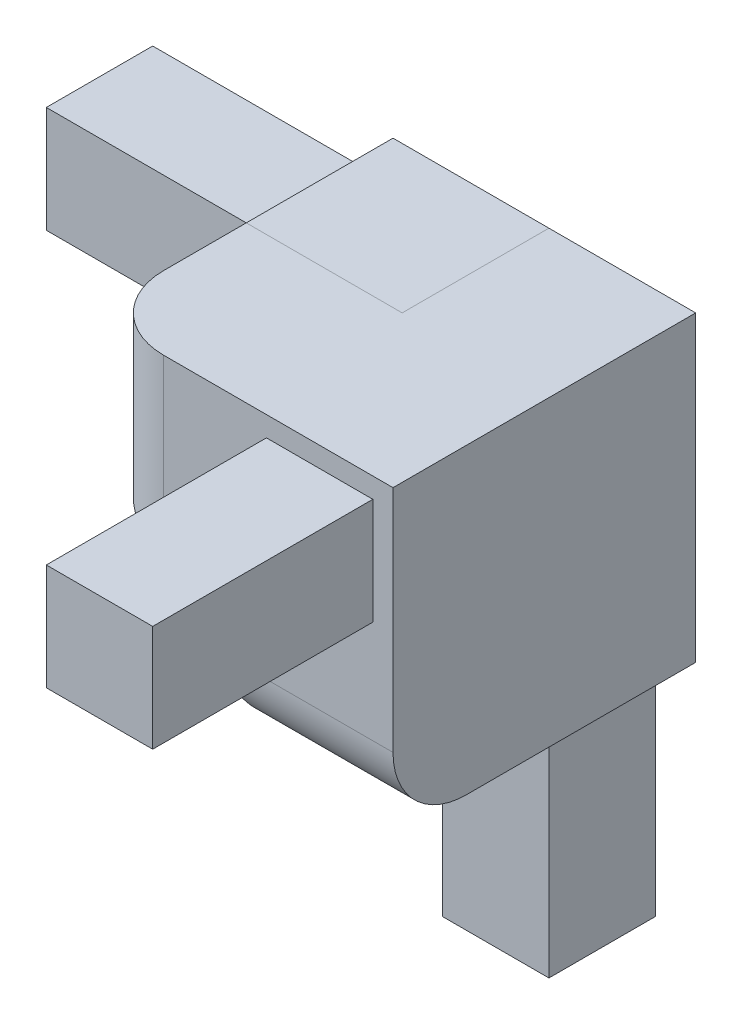
from build123d import *

# Parameters (mm, degrees)
BOSS_EXTRUDE1_DEPTH     = 12
BOSS_EXTRUDE2_DEPTH     = 12
BOSS_EXTRUDE3_DEPTH     = 12
SKETCH4_W               = 8
SKETCH4_H               = 8
BOSS_EXTRUDE4_DEPTH     = 16.5
SKETCH5_W               = 7.999993884
SKETCH5_H               = 7.999993884
BOSS_EXTRUDE5_DEPTH     = 16.5
SKETCH6_W               = 8
SKETCH6_H               = 8
BOSS_EXTRUDE6_DEPTH     = 16.5
SKETCH8_W               = 16.5
SKETCH8_H               = 16.5
BOSS_EXTRUDE7_DEPTH     = 16.5
CUT_EXTRUDE1_DEPTH      = 46.53156728
CUT_EXTRUDE1_DEPTH_BACK = 10
SKETCH7_R               = 3.375
FILLET2_R               = 4
THREAD1_PITCH           = 1.25
CUT_EXTRUDE4_REACH      = 46.455
SKETCH13_R              = 7.5


with BuildPart() as part:
    # Sketch1 → Boss-Extrude1 (new body)
    with BuildSketch(Plane(origin=(0, 35.05419916, 0), x_dir=(0.9999999620637957, 0, 0.0002754494639987689), z_dir=(0, 1, 0))):
        Polygon((19.155740079, 21.200002591), (24.955739859, 21.201600197), (24.954142252, 27.001599977), (19.154142472, 27.00000237), align=None)
    extrude(amount=-BOSS_EXTRUDE1_DEPTH)



with BuildPart() as body_2:
    # Sketch2 → Boss-Extrude2 (new body)
    with BuildSketch(Plane(origin=(9.561578882, 0, 0), x_dir=(0, 7.645378823372435e-07, -0.9999999999997079), z_dir=(1, 0, 0))):
        Polygon((26.994759488, 44.654178522), (26.994763922, 50.454178522), (21.194763922, 50.454182956), (21.194759488, 44.654182956), align=None)
    extrude(amount=-BOSS_EXTRUDE2_DEPTH)



with BuildPart() as body_3:
    # Sketch3 → Boss-Extrude3 (new body)
    with BuildSketch(Plane(origin=(0, 0, -11.594725348), x_dir=(-0.9999999616408898, -0.00027698053959765754, 0), z_dir=(0, 0, -1))):
        Polygon((-24.975552756, 50.447283353), (-24.973946268, 44.647283576), (-19.173946491, 44.648890063), (-19.175552978, 50.448889841), align=None)
    extrude(amount=-BOSS_EXTRUDE3_DEPTH)

    # Sketch4 → Boss-Extrude4 (add)
    with BuildSketch(Plane(origin=(0, 0, -11.594725348), x_dir=(-1, 0, 0), z_dir=(0, 0, -1))):
        with Locations((-22.061578882, 47.55419916)):
            Rectangle(SKETCH4_W, SKETCH4_H)
    extrude(amount=BOSS_EXTRUDE4_DEPTH)


with BuildPart() as body_2_1:
    add(body_2.part)

    add(body_3.part)  # Boss-Extrude5 merges body 3
    # Sketch5 → Boss-Extrude5 (add)
    with BuildSketch(Plane(origin=(9.561578882, 0, 0), x_dir=(0, 7.645378823474896e-07, -0.9999999999997079), z_dir=(1, 0, 0))):
        with Locations((24.094767821, 47.554180739)):
            Rectangle(SKETCH5_W, SKETCH5_H)
    extrude(amount=BOSS_EXTRUDE5_DEPTH)


with BuildPart() as part_1:
    add(part.part)

    add(body_2_1.part)  # Boss-Extrude6 merges body 2
    # Sketch6 → Boss-Extrude6 (add)
    with BuildSketch(Plane(origin=(0, 35.05419916, 0), x_dir=(1, 0, 0), z_dir=(0, 1, 0))):
        with Locations((22.061578882, 24.094737957)):
            Rectangle(SKETCH6_W, SKETCH6_H)
    extrude(amount=BOSS_EXTRUDE6_DEPTH)

    # Sketch8 → Boss-Extrude7 (add)
    with BuildSketch(Plane.XY.offset(-11.594725348)):
        with Locations((17.811578882, 43.30419916)):
            Rectangle(SKETCH8_W, SKETCH8_H)
    extrude(amount=-BOSS_EXTRUDE7_DEPTH)

    # Sketch7 → Cut-Extrude1 (cut, two sides: drawn at the far end of the back side and taken through both)
    with BuildSketch(Plane(origin=(24.403518903, 24.403519985, -24.403483784), x_dir=(-0.8164963911191215, 0.4082487828215975, -0.40824817772298094), z_dir=(-0.577350537619435, -0.5773505632103234, 0.5773497067387079)).offset(-CUT_EXTRUDE1_DEPTH_BACK)):
        with Locations((11.237364984, -16.588328554)):
            Circle(SKETCH7_R)
    extrude(amount=CUT_EXTRUDE1_DEPTH + CUT_EXTRUDE1_DEPTH_BACK, mode=Mode.SUBTRACT)

    # Fillet2
    fillet2_edges = [part_1.edges().sort_by_distance(p)[0] for p in [
        (19.878336333, 35.05419916, -11.594725348),
        (9.561578882, 45.370956657, -11.594725348),
        (9.561578882, 35.05419916, -21.911481312),
    ]]
    fillet(fillet2_edges, radius=FILLET2_R)

    # Thread1: the profile of Thread Profile1 profile screwed along a right-hand helix of 16 turns, 8 arcs to a turn; built about Z, then put on its axis
    thread1_z = Axis((0, 0, 0), (0, 0, 1))
    thread1_corners = [(3.3747, 1e-09, -0.000173204), (4.051582343, 1e-09, 0.390624999), (4.051582343, 1e-09, 0.546874999), (3.374699999, 1e-09, 0.937673202)]
    with BuildLine(mode=Mode.PRIVATE) as thread1_profile:
        Line(thread1_corners[0], thread1_corners[1])
        Line(thread1_corners[1], thread1_corners[2])
        Line(thread1_corners[2], thread1_corners[3])
        Line(thread1_corners[3], thread1_corners[0])
    thread1_cap = Face(thread1_profile.wire())
    thread1_turn_angles = [0, 22.5, 45, 67.5, 90, 112.5, 135, 157.5, 180, 202.5, 225, 247.5, 270, 292.5, 315, 337.5, 360]
    thread1_turn_weights = [1, 0.9238795325112867, 1, 0.9238795325112867, 1, 0.9238795325112867, 1, 0.9238795325112867, 1, 0.9238795325112867, 1, 0.9238795325112867, 1, 0.9238795325112867, 1, 0.9238795325112867, 1]
    thread1_turn_rails = [Edge.make_bspline([Vector(p[0], p[1], 0).rotate(thread1_z, thread1_turn_angles[k]) / thread1_turn_weights[k] + Vector(0, 0, p[2] + THREAD1_PITCH * thread1_turn_angles[k] / 360) for k in range(17)], [0, 0, 0, 1, 1, 2, 2, 3, 3, 4, 4, 5, 5, 6, 6, 7, 7, 8, 8, 8], 2, thread1_turn_weights) for p in thread1_corners]
    thread1_turn_sides = [Face.make_surface_from_curves(thread1_turn_rails[p[0]], thread1_turn_rails[p[1]]) for p in [(0, 1), (1, 2), (2, 3), (3, 0)]]
    thread1 = Plane(origin=(21.001756319, 46.494377105, -23.034886322), x_dir=(-0.816496391, 0.408248783, -0.408248177), z_dir=(-0.577350538, -0.577350563, 0.577349707)) * Solid(Shell([*[p.moved(Location((0, 0, THREAD1_PITCH * i))) for i in range(16) for p in thread1_turn_sides], thread1_cap, thread1_cap.rotate(thread1_z, 5760).moved(Location((0, 0, THREAD1_PITCH * 5760 / 360)))]))
    add(thread1, mode=Mode.SUBTRACT)

    # Sketch13 → Cut-Extrude4 (cut, up to next)
    with BuildSketch(Plane(origin=(22.102133986, 22.102134965, -22.102102178), x_dir=(0.4082478924916615, 0.40824789301034875, 0.8164969786402934), z_dir=(-0.577350537619435, -0.5773505632103231, 0.5773497067387081)), mode=Mode.PRIVATE) as cut_extrude4_sk1:
        with Locations((8.747239161, 18.026004079)):
            Circle(SKETCH13_R)
    cut_extrude4_tool1 = extrude(cut_extrude4_sk1.sketch, amount=CUT_EXTRUDE4_REACH, mode=Mode.PRIVATE) & part_1.part
    add(cut_extrude4_tool1.solids().sort_by_distance((12.926866, 38.419486, -14.960008))[0], mode=Mode.SUBTRACT)


solid = part_1.part
